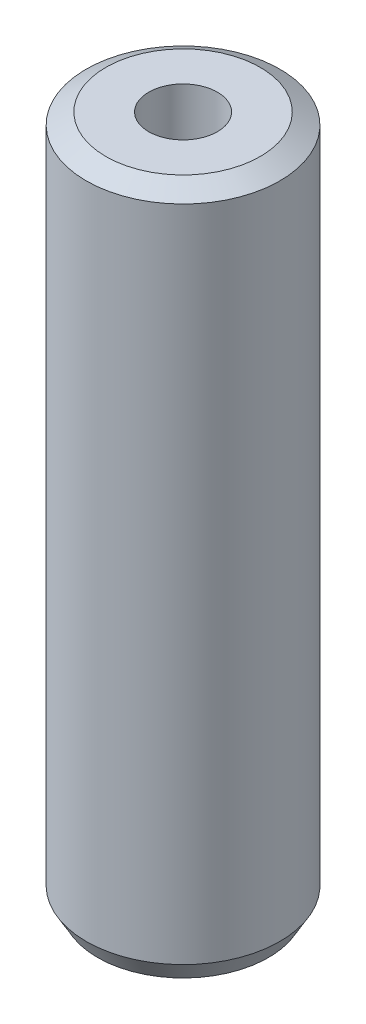
from build123d import *
from OCP.BRepFilletAPI import BRepFilletAPI_MakeChamfer

# Parameters (mm, degrees)
SKETCH1_R           = 5
BOSS_EXTRUDE1_DEPTH = 35.610279331
SKETCH2_R           = 1.772296055
CUT_EXTRUDE1_DEPTH  = 37.305536685
CHAMFER1_SIZE       = 0.583944176
CHAMFER1_SIZE2      = 1.011420981


with BuildPart() as part:
    # Sketch1 → Boss-Extrude1 (new body)
    with BuildSketch(Plane(origin=(0, 0, 0), x_dir=(1, 0, 0), z_dir=(0, 1, 0))):
        Circle(SKETCH1_R)
    extrude(amount=BOSS_EXTRUDE1_DEPTH)

    # Sketch2 → Cut-Extrude1 (cut, through all)
    with BuildSketch(Plane(origin=(0, 0, 0), x_dir=(1, 0, 0), z_dir=(0, 1, 0))):
        Circle(SKETCH2_R)
    extrude(amount=CUT_EXTRUDE1_DEPTH, mode=Mode.SUBTRACT)

    # Chamfer1: one chamfer whose edges measure the first distance from different faces: ONE call of the kernel's chamfer builder (chamfer() names one face for all edges)
    chamfer1_edges_1 = [part.edges().sort_by_distance(p)[0] for p in [
        (-5, 35.610279331, 0),
    ]]
    chamfer1_side_1 = [part.faces().sort_by_distance(p)[0] for p in [
        (-5, 17.805139665, 0),
    ]]
    chamfer1_edges_2 = [part.edges().sort_by_distance(p)[0] for p in [
        (-5, 0, 0),
    ]]
    chamfer1_side_2 = [part.faces().sort_by_distance(p)[0] for p in [
        (-4.858578644, 0, 0),
    ]]
    chamfer1 = BRepFilletAPI_MakeChamfer(part.part.solid().wrapped)
    for e in chamfer1_edges_1:
        chamfer1.Add(CHAMFER1_SIZE, CHAMFER1_SIZE2, e.wrapped, chamfer1_side_1[0].wrapped)  # the first distance lies on this face
    for e in chamfer1_edges_2:
        chamfer1.Add(CHAMFER1_SIZE, CHAMFER1_SIZE2, e.wrapped, chamfer1_side_2[0].wrapped)  # the first distance lies on this face
    add(Compound.cast(chamfer1.Shape()), mode=Mode.REPLACE)


solid = part.part
